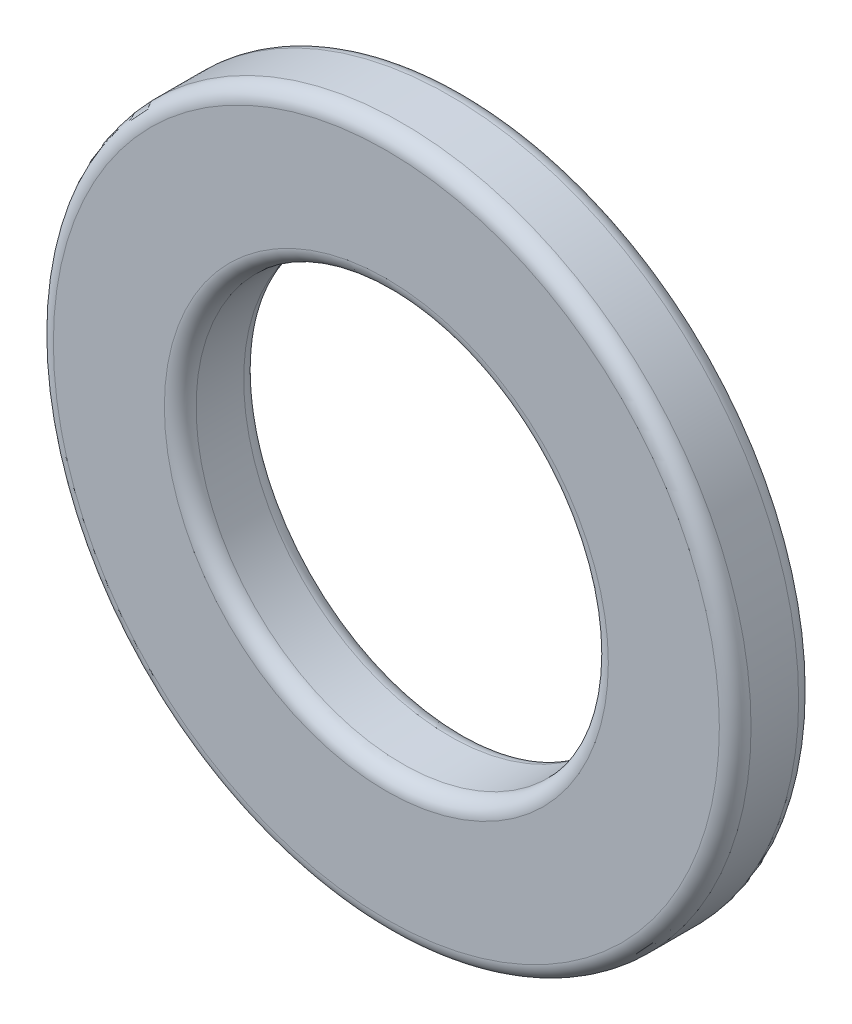
from build123d import *

# Parameters (mm, degrees)
SKETCH1_R           = 11
SKETCH1_R_2         = 6.5
BOSS_EXTRUDE1_DEPTH = 2.5
FILLET1_R           = 0.5


with BuildPart() as part:
    # Sketch1 → Boss-Extrude1 (new body)
    with BuildSketch(Plane.XY):
        Circle(SKETCH1_R)
        Circle(SKETCH1_R_2, mode=Mode.SUBTRACT)
    extrude(amount=BOSS_EXTRUDE1_DEPTH)

    # Fillet1
    fillet1_edges = [part.edges().sort_by_distance(p)[0] for p in [
        (-6.5, 0, 0),
        (-11, 0, 0),
        (-11, 0, 2.5),
        (-6.5, 0, 2.5),
    ]]
    fillet(fillet1_edges, radius=FILLET1_R)


solid = part.part
